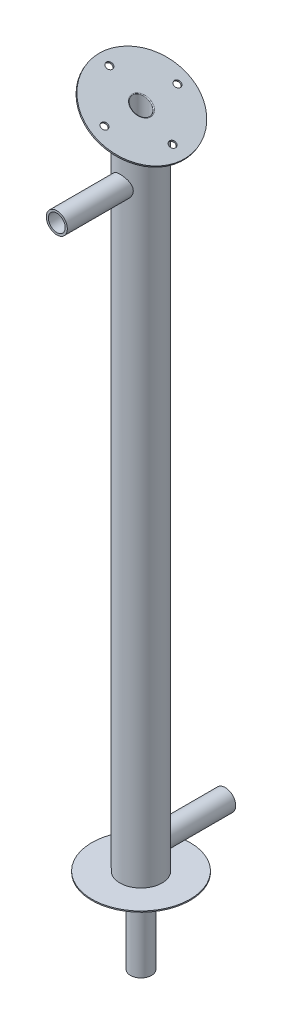
from build123d import *

# Parameters (mm, degrees)
SKETCH1_R                = 19.05
BOSS_EXTRUDE1_DEPTH      = 609.6
SKETCH2_R                = 33.02
BOSS_EXTRUDE2_DEPTH      = 1
SKETCH3_R                = 44.45
BOSS_EXTRUDE3_DEPTH      = 1.016
SHELL2_START             = -0.016
SHELL2_OUTLINE_R         = 18.05
SHELL2_DEPTH             = 610.616
CUT_EXTRUDE3_REACH       = 616.838
SKETCH8_R                = 4
BOSS_EXTRUDE6_START      = 76.2
SKETCH9_R                = 9.525
BOSS_EXTRUDE6_DEPTH      = 682.752
CUT_EXTRUDE5_REACH       = 692.683
SKETCH13_R               = 2.032
CUT_EXTRUDE7_DEPTH       = 101.6
SKETCH17_R               = 44.45
BOSS_EXTRUDE7_DEPTH      = 1.524
CUT_EXTRUDE6_REACH       = 704.182
SKETCH15_R               = 7.62
CUT_EXTRUDE8_REACH       = 612.644
SKETCH19_R               = 3.048
BOSS_EXTRUDE8_REACH      = 637.294
BOSS_EXTRUDE8_END_RADIUS = 19.05
SKETCH20_R               = 9.525
CUT_EXTRUDE9_REACH       = 637.294
CUT_EXTRUDE9_END_RADIUS  = 18.05
SKETCH21_R               = 7.62
BOSS_EXTRUDE9_REACH      = 644.081
BOSS_EXTRUDE9_END_RADIUS = 19.05
SKETCH6_R                = 9.525
CUT_EXTRUDE10_REACH      = 644.081
CUT_EXTRUDE10_END_RADIUS = 18.05
SKETCH22_R               = 7.62
FILLET1_R                = 0.762


# Read off the part's stored shape, not the designer's step: Shell2
with BuildPart() as part:
    # Sketch1 → Boss-Extrude1 (new body)
    with BuildSketch(Plane(origin=(0, 0, 0), x_dir=(1, 0, 0), z_dir=(0, 1, 0))):
        with Locations(Location((0, 0, 0), (0, 0, 90))):
            Circle(SKETCH1_R)
    extrude(amount=BOSS_EXTRUDE1_DEPTH)

    # Sketch2 → Boss-Extrude2 (add)
    with BuildSketch(Plane(origin=(0, 609.6, 0), x_dir=(1, 0, 0), z_dir=(0, 1, 0))):
        with Locations(Location((0, 0, 0), (0, 0, 270))):
            Circle(SKETCH2_R)
    extrude(amount=BOSS_EXTRUDE2_DEPTH)

    # Sketch3 → Boss-Extrude3 (add)
    with BuildSketch(Plane.XZ):
        with Locations(Location((0, 0, 0), (0, 0, 270))):
            Circle(SKETCH3_R)
    extrude(amount=BOSS_EXTRUDE3_DEPTH)

    # Shell2 outline → Shell2 (cut)
    with BuildSketch(Plane(origin=(0, 0, 0), x_dir=(1, 0, 0), z_dir=(0, 1, 0)).offset(SHELL2_START)):
        Circle(SHELL2_OUTLINE_R)
    extrude(amount=SHELL2_DEPTH, mode=Mode.SUBTRACT)

    # Sketch8 → Cut-Extrude3 (cut, up to next)
    with BuildSketch(Plane.XZ.offset(1.016), mode=Mode.PRIVATE) as cut_extrude3_sk1:
        with Locations(Location((0, 0, 0), (0, 0, 270))):
            Circle(SKETCH8_R)
    cut_extrude3_tool1 = extrude(cut_extrude3_sk1.sketch, amount=-CUT_EXTRUDE3_REACH, mode=Mode.PRIVATE) & part.part
    add(cut_extrude3_tool1.solids().sort_by_distance((0, -1.016, 0))[0], mode=Mode.SUBTRACT)

    # Sketch9 → Boss-Extrude6 (add)
    with BuildSketch(Plane.XZ.offset(1.016).offset(BOSS_EXTRUDE6_START)):
        with Locations(Location((0, 0, 0), (0, 0, 270))):
            Circle(SKETCH9_R)
    extrude(amount=-BOSS_EXTRUDE6_DEPTH)

    # Sketch13 → Cut-Extrude5 (cut, up to next)
    with BuildSketch(Plane(origin=(0, 610.6, 0), x_dir=(1, 0, 0), z_dir=(0, 1, 0)), mode=Mode.PRIVATE) as cut_extrude5_sk1:
        with Locations((33.02, 0)):
            Circle(SKETCH13_R)
    cut_extrude5_tool1 = extrude(cut_extrude5_sk1.sketch, amount=-CUT_EXTRUDE5_REACH, mode=Mode.PRIVATE) & part.part
    # Sketch13 → Cut-Extrude5 (cut, up to next)
    with BuildSketch(Plane(origin=(0, 610.6, 0), x_dir=(1, 0, 0), z_dir=(0, 1, 0)), mode=Mode.PRIVATE) as cut_extrude5_sk2:
        with Locations((0, -33.02)):
            Circle(SKETCH13_R)
    cut_extrude5_tool2 = extrude(cut_extrude5_sk2.sketch, amount=-CUT_EXTRUDE5_REACH, mode=Mode.PRIVATE) & part.part
    # Sketch13 → Cut-Extrude5 (cut, up to next)
    with BuildSketch(Plane(origin=(0, 610.6, 0), x_dir=(1, 0, 0), z_dir=(0, 1, 0)), mode=Mode.PRIVATE) as cut_extrude5_sk3:
        with Locations((-33.02, 0)):
            Circle(SKETCH13_R)
    cut_extrude5_tool3 = extrude(cut_extrude5_sk3.sketch, amount=-CUT_EXTRUDE5_REACH, mode=Mode.PRIVATE) & part.part
    # Sketch13 → Cut-Extrude5 (cut, up to next)
    with BuildSketch(Plane(origin=(0, 610.6, 0), x_dir=(1, 0, 0), z_dir=(0, 1, 0)), mode=Mode.PRIVATE) as cut_extrude5_sk4:
        with Locations((0, 33.02)):
            Circle(SKETCH13_R)
    cut_extrude5_tool4 = extrude(cut_extrude5_sk4.sketch, amount=-CUT_EXTRUDE5_REACH, mode=Mode.PRIVATE) & part.part
    add(cut_extrude5_tool1.solids().sort_by_distance((33.02, 610.6, 0))[0], mode=Mode.SUBTRACT)
    add(cut_extrude5_tool2.solids().sort_by_distance((0, 610.6, 33.02))[0], mode=Mode.SUBTRACT)
    add(cut_extrude5_tool3.solids().sort_by_distance((-33.02, 610.6, 0))[0], mode=Mode.SUBTRACT)
    add(cut_extrude5_tool4.solids().sort_by_distance((0, 610.6, -33.02))[0], mode=Mode.SUBTRACT)

    # Sketch16 → Cut-Extrude7 (cut, symmetric)
    with BuildSketch(Plane.XY):
        Polygon((-19.05, 609.6), (21.997088087, 585.901452644), (42.636046977, 621.649178056), (-50.106890551, 621.649178056), (-50.106890551, 605.108969251), (-23.589505284, 605.108969251), align=None)
    extrude(amount=CUT_EXTRUDE7_DEPTH, both=True, mode=Mode.SUBTRACT)

    # Sketch17 → Boss-Extrude7 (add)
    with BuildSketch(Plane(origin=(259.202043073, 448.951108029, 0), x_dir=(0.8660254037844417, -0.49999999999999495, 0), z_dir=(0.49999999999999495, 0.8660254037844417, 0))):
        with Locations(Location((-299.300738686, 0, 0), (0, 0, 180))):
            Circle(SKETCH17_R)
    extrude(amount=BOSS_EXTRUDE7_DEPTH)

    # Cut-Extrude6: up to this plane
    cut_extrude6_end = Plane(origin=(0.762, 599.921300087, 0), z_dir=(0.49999999999999495, 0.8660254037844417, 0))
    # Sketch15 → Cut-Extrude6 (cut, up to the surface)
    with BuildSketch(Plane.XZ.offset(77.216), mode=Mode.PRIVATE) as cut_extrude6_sk1:
        with Locations(Location((0, 0, 0), (0, 0, 270))):
            Circle(SKETCH15_R)
    cut_extrude6_tool1 = split(extrude(cut_extrude6_sk1.sketch, amount=-CUT_EXTRUDE6_REACH, mode=Mode.PRIVATE), bisect_by=cut_extrude6_end, keep=Keep.BOTH, mode=Mode.PRIVATE)
    add(cut_extrude6_tool1.solids().sort_by_distance((0, -77.216, 0))[0], mode=Mode.SUBTRACT)

    # Sketch19 → Cut-Extrude8 (cut, up to next)
    with BuildSketch(Plane(origin=(259.964043073, 450.270930744, 0), x_dir=(0.8660254037844416, -0.499999999999995, 0), z_dir=(0.49999999999999495, 0.8660254037844415, 0)), mode=Mode.PRIVATE) as cut_extrude8_sk1:
        with Locations(Location((-267.160620496, 0, 0), (0, 0, 180))):
            Circle(SKETCH19_R)
    cut_extrude8_tool1 = extrude(cut_extrude8_sk1.sketch, amount=-CUT_EXTRUDE8_REACH, mode=Mode.PRIVATE) & part.part
    # Sketch19 → Cut-Extrude8 (cut, up to next)
    with BuildSketch(Plane(origin=(259.964043073, 450.270930744, 0), x_dir=(0.8660254037844416, -0.499999999999995, 0), z_dir=(0.49999999999999495, 0.8660254037844415, 0)), mode=Mode.PRIVATE) as cut_extrude8_sk2:
        with Locations(Location((-300.180620496, -33.02, 0), (0, 0, 180))):
            Circle(SKETCH19_R)
    cut_extrude8_tool2 = extrude(cut_extrude8_sk2.sketch, amount=-CUT_EXTRUDE8_REACH, mode=Mode.PRIVATE) & part.part
    # Sketch19 → Cut-Extrude8 (cut, up to next)
    with BuildSketch(Plane(origin=(259.964043073, 450.270930744, 0), x_dir=(0.8660254037844416, -0.499999999999995, 0), z_dir=(0.49999999999999495, 0.8660254037844415, 0)), mode=Mode.PRIVATE) as cut_extrude8_sk3:
        with Locations(Location((-333.200620496, 0, 0), (0, 0, 180))):
            Circle(SKETCH19_R)
    cut_extrude8_tool3 = extrude(cut_extrude8_sk3.sketch, amount=-CUT_EXTRUDE8_REACH, mode=Mode.PRIVATE) & part.part
    # Sketch19 → Cut-Extrude8 (cut, up to next)
    with BuildSketch(Plane(origin=(259.964043073, 450.270930744, 0), x_dir=(0.8660254037844416, -0.499999999999995, 0), z_dir=(0.49999999999999495, 0.8660254037844415, 0)), mode=Mode.PRIVATE) as cut_extrude8_sk4:
        with Locations(Location((-300.180620496, 33.02, 0), (0, 0, 180))):
            Circle(SKETCH19_R)
    cut_extrude8_tool4 = extrude(cut_extrude8_sk4.sketch, amount=-CUT_EXTRUDE8_REACH, mode=Mode.PRIVATE) & part.part
    add(cut_extrude8_tool1.solids().sort_by_distance((28.596159, 583.851241, 0))[0], mode=Mode.SUBTRACT)
    add(cut_extrude8_tool2.solids().sort_by_distance((0, 600.361241, 33.02))[0], mode=Mode.SUBTRACT)
    add(cut_extrude8_tool3.solids().sort_by_distance((-28.596159, 616.871241, 0))[0], mode=Mode.SUBTRACT)
    add(cut_extrude8_tool4.solids().sort_by_distance((0, 600.361241, -33.02))[0], mode=Mode.SUBTRACT)

    # Boss-Extrude8: up to this cylinder (the profile starts outside it)
    boss_extrude8_end = Plane(origin=(0, 546.1, 0), z_dir=(0, -1, 0)) * Cylinder(BOSS_EXTRUDE8_END_RADIUS, 1313.688, mode=Mode.PRIVATE)
    # Sketch20 → Boss-Extrude8 (add, up to the surface)
    with BuildSketch(Plane.XY.offset(76.2), mode=Mode.PRIVATE) as boss_extrude8_sk1:
        with Locations((0, 546.1)):
            Circle(SKETCH20_R)
    boss_extrude8_tool1 = extrude(boss_extrude8_sk1.sketch, amount=-BOSS_EXTRUDE8_REACH, mode=Mode.PRIVATE) - boss_extrude8_end
    add(boss_extrude8_tool1.solids().sort_by_distance((0, 546.1, 76.2))[0])

    # Cut-Extrude9: up to this cylinder (the profile starts outside it)
    cut_extrude9_end = Plane(origin=(0, 546.1, 0), z_dir=(0, -1, 0)) * Cylinder(CUT_EXTRUDE9_END_RADIUS, 1311.688, mode=Mode.PRIVATE)
    # Sketch21 → Cut-Extrude9 (cut, up to the surface)
    with BuildSketch(Plane.XY.offset(76.2), mode=Mode.PRIVATE) as cut_extrude9_sk1:
        with Locations((0, 546.1)):
            Circle(SKETCH21_R)
    cut_extrude9_tool1 = extrude(cut_extrude9_sk1.sketch, amount=-CUT_EXTRUDE9_REACH, mode=Mode.PRIVATE) - cut_extrude9_end
    add(cut_extrude9_tool1.solids().sort_by_distance((0, 546.1, 76.2))[0], mode=Mode.SUBTRACT)

    # Boss-Extrude9: up to this cylinder (the profile starts outside it)
    boss_extrude9_end = Plane(origin=(0, 17.78, 0), z_dir=(0, -1, 0)) * Cylinder(BOSS_EXTRUDE9_END_RADIUS, 1327.262, mode=Mode.PRIVATE)
    # Sketch6 → Boss-Extrude9 (add, up to the surface)
    with BuildSketch(Plane.XY.offset(-76.2), mode=Mode.PRIVATE) as boss_extrude9_sk1:
        with Locations(Location((0, 17.78, 0), (0, 0, 90))):
            Circle(SKETCH6_R)
    boss_extrude9_tool1 = extrude(boss_extrude9_sk1.sketch, amount=BOSS_EXTRUDE9_REACH, mode=Mode.PRIVATE) - boss_extrude9_end
    add(boss_extrude9_tool1.solids().sort_by_distance((0, 17.78, -76.2))[0])

    # Cut-Extrude10: up to this cylinder (the profile starts outside it)
    cut_extrude10_end = Plane(origin=(0, 17.78, 0), z_dir=(0, -1, 0)) * Cylinder(CUT_EXTRUDE10_END_RADIUS, 1325.262, mode=Mode.PRIVATE)
    # Sketch22 → Cut-Extrude10 (cut, up to the surface)
    with BuildSketch(Plane(origin=(0, 0, -76.2), x_dir=(-1, 0, 0), z_dir=(0, 0, -1)), mode=Mode.PRIVATE) as cut_extrude10_sk1:
        with Locations((0, 17.78)):
            Circle(SKETCH22_R)
    cut_extrude10_tool1 = extrude(cut_extrude10_sk1.sketch, amount=-CUT_EXTRUDE10_REACH, mode=Mode.PRIVATE) - cut_extrude10_end
    add(cut_extrude10_tool1.solids().sort_by_distance((0, 17.78, -76.2))[0], mode=Mode.SUBTRACT)

    # Fillet1
    fillet1_edges = [part.edges().sort_by_distance(p)[0] for p in [
        (-0.000177027, 600.361343199, 7.619999998),
    ]]
    fillet(fillet1_edges, radius=FILLET1_R)


solid = part.part
